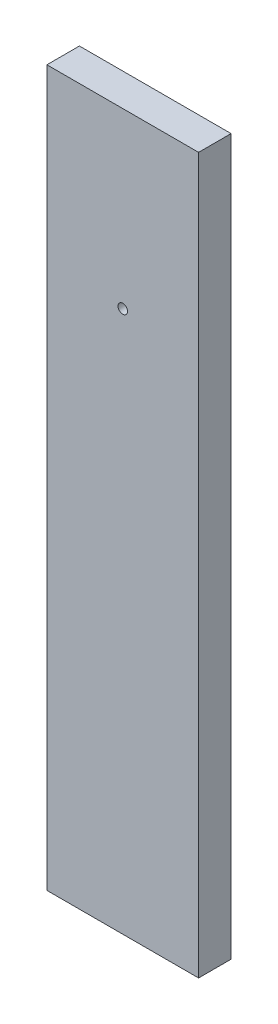
from build123d import *

# Parameters (mm, degrees)
SKETCH1_W           = 88.9
SKETCH1_H           = 19.05
BOSS_EXTRUDE1_DEPTH = 419.1
SKETCH2_R           = 2.778125
CUT_EXTRUDE1_DEPTH  = 429.848367725


with BuildPart() as part:
    # Sketch1 → Boss-Extrude1 (new body)
    with BuildSketch(Plane(origin=(0, 0, 0), x_dir=(1, 0, 0), z_dir=(0, 1, 0))):
        with Locations((44.45, 9.525)):
            Rectangle(SKETCH1_W, SKETCH1_H)
    extrude(amount=BOSS_EXTRUDE1_DEPTH)

    # Sketch2 → Cut-Extrude1 (cut, through all)
    with BuildSketch(Plane.XY):
        with Locations((44.45, 317.5)):
            Circle(SKETCH2_R)
    extrude(amount=-CUT_EXTRUDE1_DEPTH, mode=Mode.SUBTRACT)


solid = part.part
